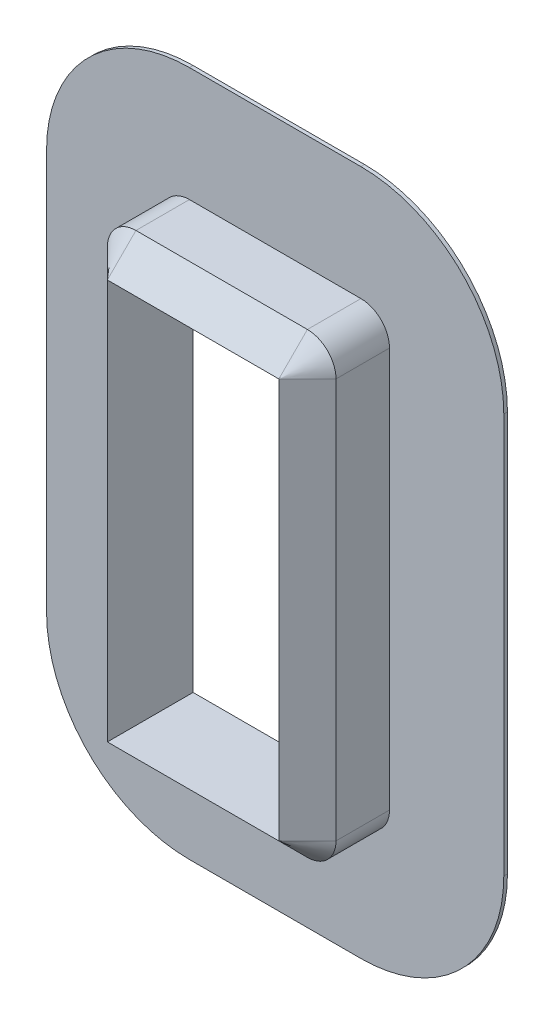
from build123d import *

# Parameters (mm, degrees)
BOSS_EXTRUDE1_DEPTH = 0.4064
SKETCH3_W           = 19.05
SKETCH3_H           = 44.45
BOSS_EXTRUDE5_DEPTH = 9.525
CHAMFER1_SIZE       = 3.175


with BuildPart() as part:
    # Sketch2 → Boss-Extrude1 (new body)
    with BuildSketch(Plane.XY):
        with BuildLine():
            Line((-9.525, 158.75), (9.525, 158.75))
            ThreePointArc((9.525, 158.75), (20.750320151, 154.100320151), (25.4, 142.875))
            Line((25.4, 142.875), (25.4, 98.425))
            ThreePointArc((25.4, 98.425), (20.750320151, 87.199679849), (9.525, 82.55))
            Line((9.525, 82.55), (-9.525, 82.55))
            ThreePointArc((-9.525, 82.55), (-20.750320151, 87.199679849), (-25.4, 98.425))
            Line((-25.4, 98.425), (-25.4, 142.875))
            ThreePointArc((-25.4, 142.875), (-20.750320151, 154.100320151), (-9.525, 158.75))
        make_face()
        with BuildLine():
            Line((-9.525, 95.25), (9.525, 95.25))
            ThreePointArc((9.525, 95.25), (11.77006403, 96.17993597), (12.7, 98.425))
            Line((12.7, 98.425), (12.7, 142.875))
            ThreePointArc((12.7, 142.875), (11.77006403, 145.12006403), (9.525, 146.05))
            Line((9.525, 146.05), (-9.525, 146.05))
            ThreePointArc((-9.525, 146.05), (-11.77006403, 145.12006403), (-12.7, 142.875))
            Line((-12.7, 142.875), (-12.7, 98.425))
            ThreePointArc((-12.7, 98.425), (-11.77006403, 96.17993597), (-9.525, 95.25))
        make_face(mode=Mode.SUBTRACT)
    extrude(amount=BOSS_EXTRUDE1_DEPTH)


with BuildPart() as body_2:
    # Sketch3 → Boss-Extrude5 (new body)
    with BuildSketch(Plane.XY):
        with BuildLine():
            Line((-9.525, 95.25), (9.525, 95.25))
            ThreePointArc((9.525, 95.25), (11.77006403, 96.17993597), (12.7, 98.425))
            Line((12.7, 98.425), (12.7, 142.875))
            ThreePointArc((12.7, 142.875), (11.77006403, 145.12006403), (9.525, 146.05))
            Line((9.525, 146.05), (-9.525, 146.05))
            ThreePointArc((-9.525, 146.05), (-11.77006403, 145.12006403), (-12.7, 142.875))
            Line((-12.7, 142.875), (-12.7, 98.425))
            ThreePointArc((-12.7, 98.425), (-11.77006403, 96.17993597), (-9.525, 95.25))
        make_face()
        with Locations((0, 120.65)):
            Rectangle(SKETCH3_W, SKETCH3_H, mode=Mode.SUBTRACT)
    extrude(amount=BOSS_EXTRUDE5_DEPTH)

    # Chamfer1
    chamfer1_edges = [body_2.edges().sort_by_distance(p)[0] for p in [
        (0, 146.05, 9.525),
        (-11.77006403, 145.12006403, 9.525),
        (-12.7, 120.65, 9.525),
        (-11.77006403, 96.17993597, 9.525),
        (0, 95.25, 9.525),
        (11.77006403, 96.17993597, 9.525),
        (12.7, 120.65, 9.525),
        (11.77006403, 145.12006403, 9.525),
    ]]
    chamfer(chamfer1_edges, length=CHAMFER1_SIZE - 0.0001)  # a hair under: the kernel refuses the full size


solid = Compound([part.part, body_2.part])
